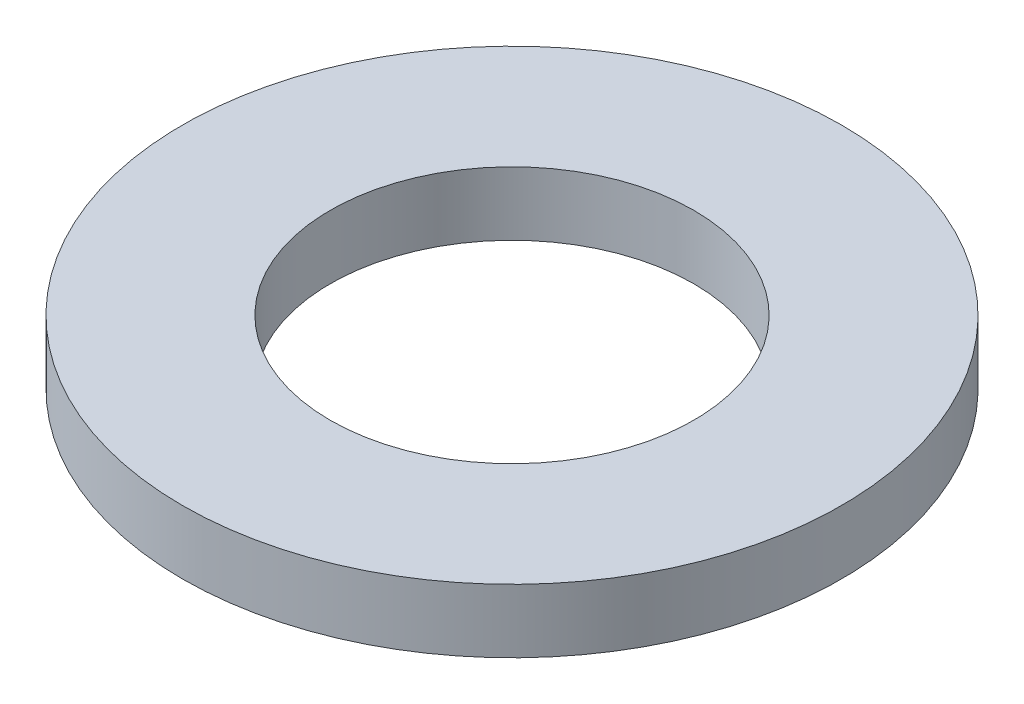
from build123d import *

# Parameters (mm, degrees)
SKETCH1_R           = 72.5
BOSS_EXTRUDE1_DEPTH = 14
SKETCH2_R           = 40
CUT_EXTRUDE1_DEPTH  = 104.481882472


with BuildPart() as part:
    # Sketch1 → Boss-Extrude1 (new body)
    with BuildSketch(Plane(origin=(0, 0, 0), x_dir=(1, 0, 0), z_dir=(0, 1, 0))):
        Circle(SKETCH1_R)
    extrude(amount=BOSS_EXTRUDE1_DEPTH)

    # Sketch2 → Cut-Extrude1 (cut, through all)
    with BuildSketch(Plane(origin=(0, 0, 0), x_dir=(1, 0, 0), z_dir=(0, 1, 0))):
        Circle(SKETCH2_R)
    extrude(amount=CUT_EXTRUDE1_DEPTH, mode=Mode.SUBTRACT)


solid = part.part
